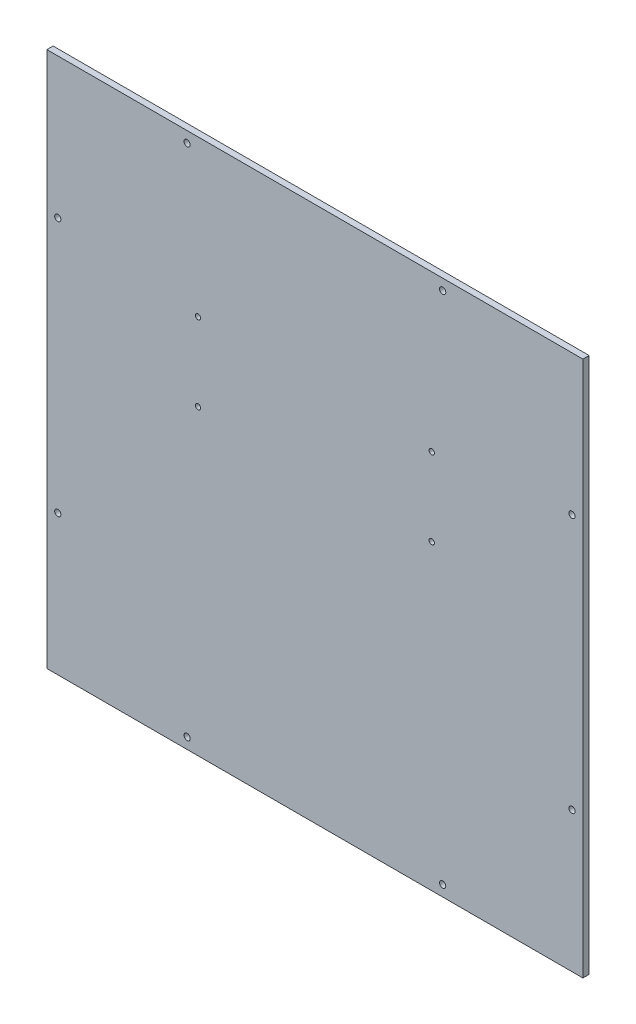
from build123d import *

# Parameters (mm, degrees)
SCHIZZO1_W                   = 344
SCHIZZO1_H                   = 344
SCHIZZO1_R                   = 2
ESTRUSIONE_ESTRUSIONE1_DEPTH = 4
SCHIZZO2_R                   = 1.7
TAGLIO_ESTRUSIONE1_DEPTH     = 487.505909522


with BuildPart() as part:
    # Schizzo1 → Estrusione-Estrusione1 (new body)
    with BuildSketch(Plane.XY):
        with Locations((172, 172)):
            Rectangle(SCHIZZO1_W, SCHIZZO1_H)
        with Locations((90, 337)):
            Circle(SCHIZZO1_R, mode=Mode.SUBTRACT)
        with Locations((254, 337)):
            Circle(SCHIZZO1_R, mode=Mode.SUBTRACT)
        with Locations((337, 254)):
            Circle(SCHIZZO1_R, mode=Mode.SUBTRACT)
        with Locations((7, 254)):
            Circle(SCHIZZO1_R, mode=Mode.SUBTRACT)
        with Locations((337, 90)):
            Circle(SCHIZZO1_R, mode=Mode.SUBTRACT)
        with Locations((254, 7)):
            Circle(SCHIZZO1_R, mode=Mode.SUBTRACT)
        with Locations((90, 7)):
            Circle(SCHIZZO1_R, mode=Mode.SUBTRACT)
        with Locations((7, 90)):
            Circle(SCHIZZO1_R, mode=Mode.SUBTRACT)
    extrude(amount=ESTRUSIONE_ESTRUSIONE1_DEPTH)

    # Schizzo2 → Taglio-Estrusione1 (cut, through all)
    with BuildSketch(Plane.XY.offset(4)):
        with Locations((97, 244)):
            Circle(SCHIZZO2_R)
        with Locations((97, 194)):
            Circle(SCHIZZO2_R)
        with Locations((247, 244)):
            Circle(SCHIZZO2_R)
        with Locations((247, 194)):
            Circle(SCHIZZO2_R)
    extrude(amount=-TAGLIO_ESTRUSIONE1_DEPTH, mode=Mode.SUBTRACT)


solid = part.part
